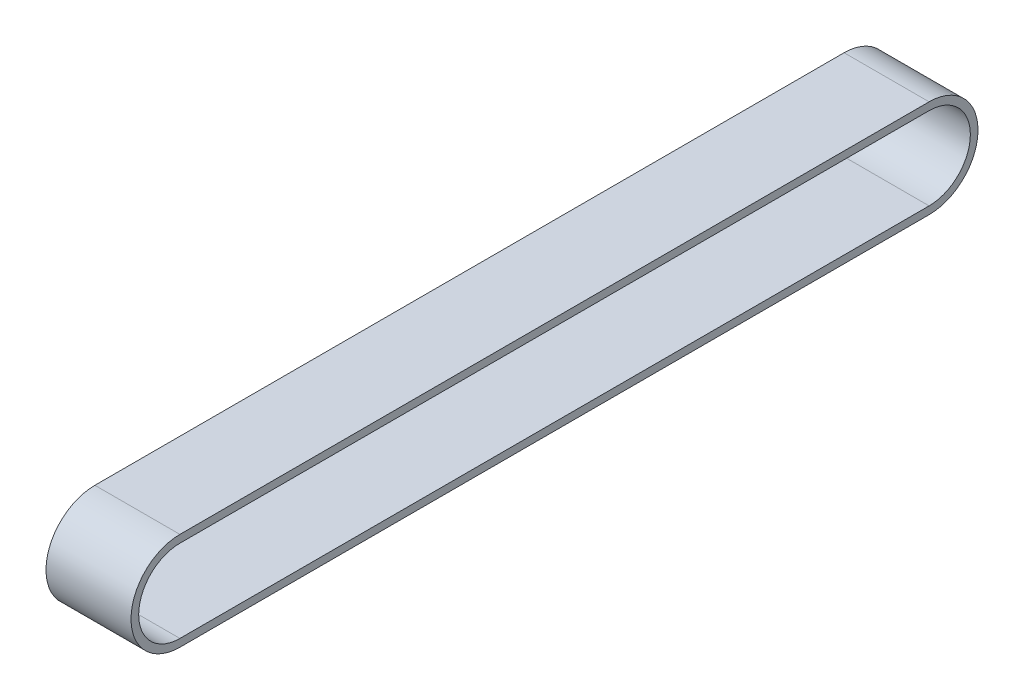
from build123d import *

# Parameters (mm, degrees)
BOSS_EXTRUDE1_DEPTH = 12.7


with BuildPart() as part:
    # Sketch1 → Boss-Extrude1 (new, symmetric)
    with BuildSketch(Plane(origin=(0, 0, 0), x_dir=(0, 0, -1), z_dir=(1, 0, 0))):
        with BuildLine():
            Line((-111.91875, 14.605), (111.91875, 14.605))
            ThreePointArc((111.91875, 14.605), (126.52375, 0), (111.91875, -14.605))
            Line((111.91875, -14.605), (-111.91875, -14.605))
            ThreePointArc((-111.91875, -14.605), (-126.52375, 0), (-111.91875, 14.605))
        make_face()
        with BuildLine():
            Line((-111.91875, 12.319), (111.91875, 12.319))
            ThreePointArc((111.91875, 12.319), (124.23775, 0), (111.91875, -12.319))
            Line((111.91875, -12.319), (-111.91875, -12.319))
            ThreePointArc((-111.91875, -12.319), (-124.23775, 0), (-111.91875, 12.319))
        make_face(mode=Mode.SUBTRACT)
    extrude(amount=BOSS_EXTRUDE1_DEPTH, both=True)


solid = part.part
